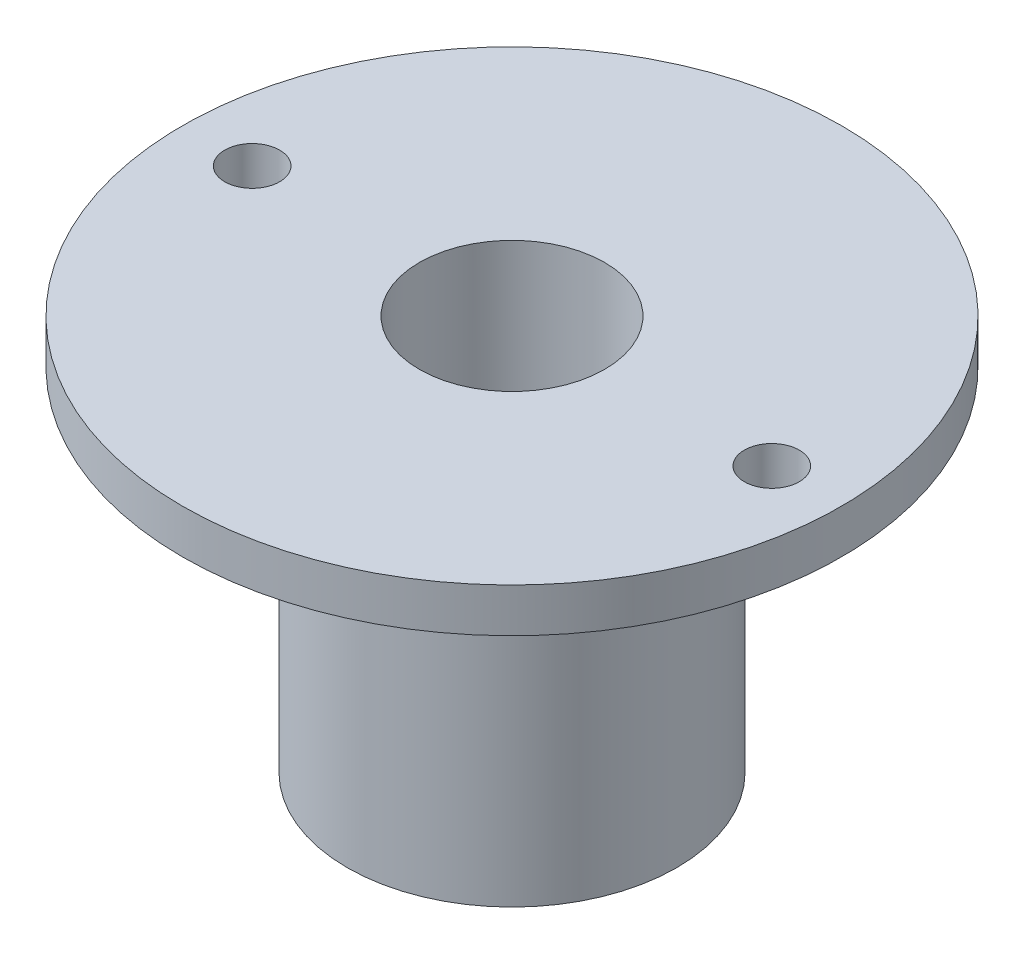
from build123d import *

# Parameters (mm, degrees)
SKETCH1_R                   = 15
BOSS_EXTRUDE1_DEPTH         = 2
SKETCH2_R                   = 7.5
BOSS_EXTRUDE2_DEPTH         = 16
F_3_8_24_TAPPED_HOLE1_D     = 8.4328
F_3_8_24_TAPPED_HOLE1_DEPTH = 24.4
F_3_8_24_TAPPED_HOLE1_TIP   = 2.533468714
SKETCH5_R                   = 1.25
CUT_EXTRUDE1_DEPTH          = 10


with BuildPart() as part:
    # Sketch1 → Boss-Extrude1 (new body)
    with BuildSketch(Plane(origin=(0, 0, 0), x_dir=(1, 0, 0), z_dir=(0, 1, 0))):
        Circle(SKETCH1_R)
    extrude(amount=-BOSS_EXTRUDE1_DEPTH)

    # Sketch2 → Boss-Extrude2 (add)
    with BuildSketch(Plane.XZ.offset(2)):
        Circle(SKETCH2_R)
    extrude(amount=BOSS_EXTRUDE2_DEPTH)

    # 3/8-24 Tapped Hole1
    with Locations(Plane(origin=(0, -18, 0), x_dir=(-1, 0, 0), z_dir=(0, -1, 0))):
        with Locations((0, 0)):
            Hole(F_3_8_24_TAPPED_HOLE1_D / 2, depth=F_3_8_24_TAPPED_HOLE1_DEPTH)
            with Locations((0, 0, -(F_3_8_24_TAPPED_HOLE1_DEPTH + F_3_8_24_TAPPED_HOLE1_TIP / 2))):  # 118° drill point
                Cone(0, F_3_8_24_TAPPED_HOLE1_D / 2, F_3_8_24_TAPPED_HOLE1_TIP, mode=Mode.SUBTRACT)

    # Sketch5 → Cut-Extrude1 (cut)
    with BuildSketch(Plane(origin=(0, 0, 0), x_dir=(1, 0, 0), z_dir=(0, 1, 0))):
        with Locations((11.825, 0)):
            Circle(SKETCH5_R)
        with Locations((-11.825, 0)):
            Circle(SKETCH5_R)
    extrude(amount=-CUT_EXTRUDE1_DEPTH, mode=Mode.SUBTRACT)


solid = part.part
